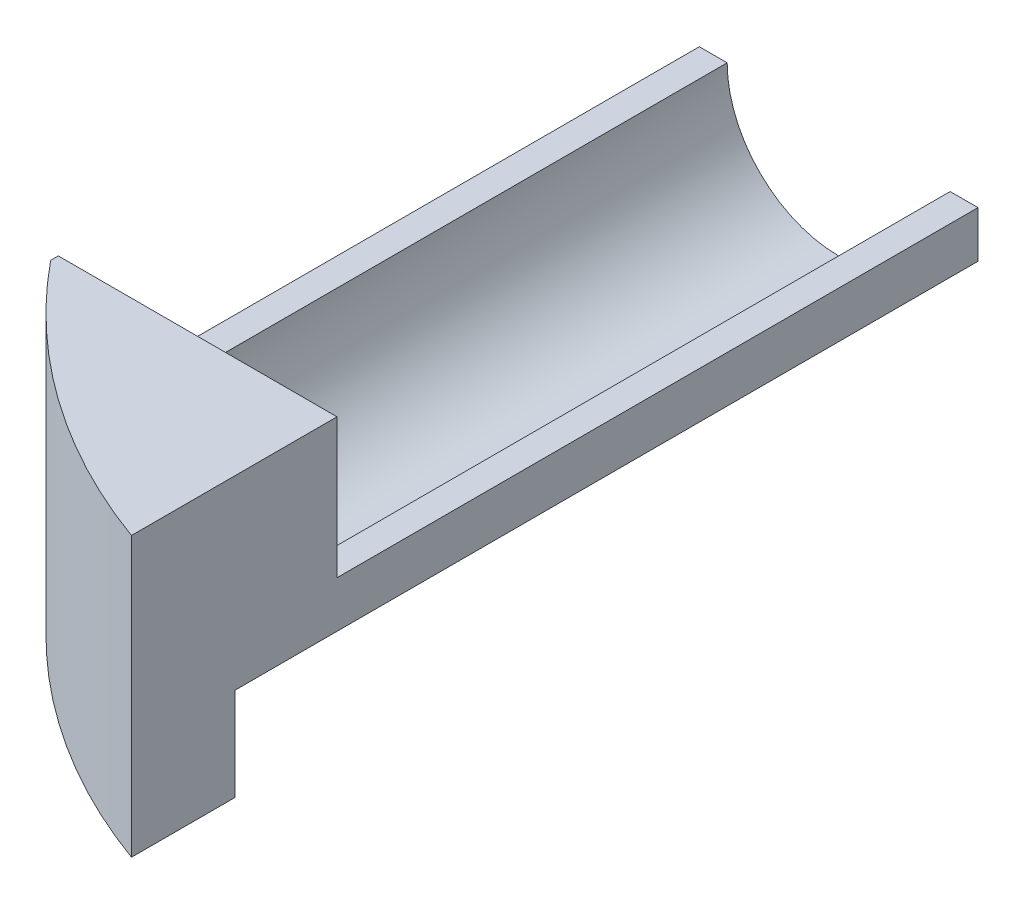
from build123d import *

# Parameters (mm, degrees)
SKETCH2_W           = 30
SKETCH2_H           = 30
BOSS_EXTRUDE1_DEPTH = 100
CUT_EXTRUDE1_START  = -30
CUT_EXTRUDE1_DEPTH  = 30
CUT_EXTRUDE2_DEPTH  = 69
CUT_EXTRUDE3_DEPTH  = 80


# Read off the part's stored shape, not the designer's step: Cut-Extrude1
with BuildPart() as part:
    # Sketch2 → Boss-Extrude1 (new body)
    with BuildSketch(Plane.XY):
        with Locations((-15, 15)):
            Rectangle(SKETCH2_W, SKETCH2_H)
    extrude(amount=BOSS_EXTRUDE1_DEPTH)

    # Cut-Extrude1 outline → Cut-Extrude1 (cut)
    with BuildSketch(Plane.XZ.offset(CUT_EXTRUDE1_START)):
        with BuildLine():
            ThreePointArc((-30, 69.824648593), (-16.445900415, 82.511221459), (0, 91.124879576))
            Line((0, 91.124879576), (0, 100))
            Line((0, 100), (-30, 100))
            Line((-30, 100), (-30, 69.824648593))
        make_face()
    extrude(amount=CUT_EXTRUDE1_DEPTH, mode=Mode.SUBTRACT)

    # Sketch4 → Cut-Extrude2 (cut)
    with BuildSketch(Plane(origin=(0, 0, 0), x_dir=(-1, 0, 0), z_dir=(0, 0, -1))):
        with BuildLine():
            Line((3, 15), (0, 15))
            Line((0, 15), (0, 30))
            Line((0, 30), (30, 30))
            Line((30, 30), (30, 15))
            Line((30, 15), (27, 15))
            ThreePointArc((27, 15), (15, 3), (3, 15))
        make_face()
    extrude(amount=-CUT_EXTRUDE2_DEPTH, mode=Mode.SUBTRACT)

    # Sketch5 → Cut-Extrude3 (cut)
    with BuildSketch(Plane(origin=(0, 0, 0), x_dir=(-1, 0, 0), z_dir=(0, 0, -1))):
        Polygon((0, 0), (0, 10), (10, 0), align=None)
    extrude(amount=-CUT_EXTRUDE3_DEPTH, mode=Mode.SUBTRACT)


solid = part.part
